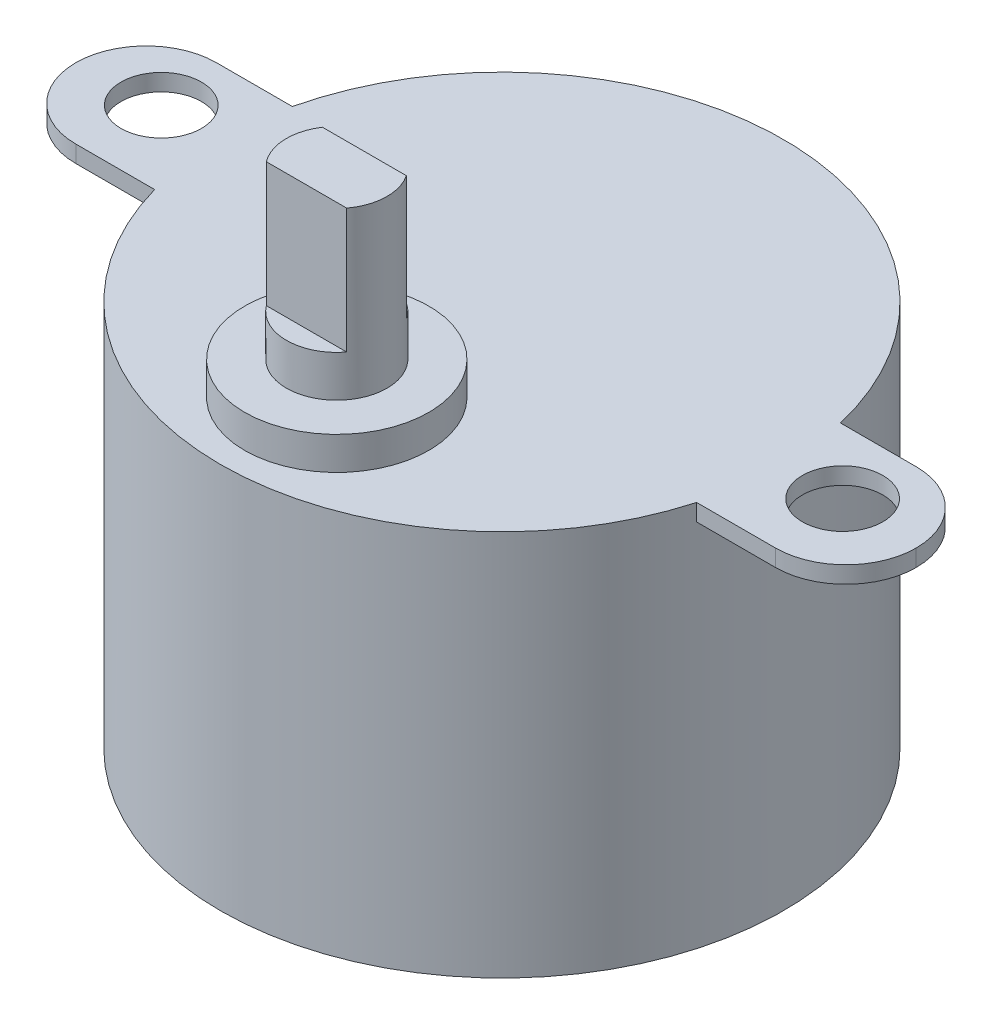
from build123d import *

# Parameters (mm, degrees)
SKETCH1_R           = 14
BOSS_EXTRUDE1_DEPTH = 19.22
SKETCH2_W           = 41.795845618
SKETCH2_H           = 7
BOSS_EXTRUDE2_DEPTH = 0.84
FILLET2_R           = 3.5
SKETCH3_R           = 2
CUT_EXTRUDE1_DEPTH  = 0.84
SKETCH4_R           = 4.58
BOSS_EXTRUDE3_DEPTH = 1.64
SKETCH5_R           = 2.5
BOSS_EXTRUDE4_DEPTH = 8.26
SKETCH6_OUTSIDE_W   = 55.422
SKETCH6_OUTSIDE_H   = 41.626
SKETCH6_OUTSIDE_W_2 = 6.15537624
SKETCH6_OUTSIDE_H_2 = 2.88
CUT_EXTRUDE2_DEPTH  = 6.2


with BuildPart() as part:
    # Sketch1 → Boss-Extrude1 (new body)
    with BuildSketch(Plane(origin=(0, 0, 0), x_dir=(1, 0, 0), z_dir=(0, 1, 0))):
        with Locations(Location((0, 0, 0), (0, 0, 270))):
            Circle(SKETCH1_R)
    extrude(amount=BOSS_EXTRUDE1_DEPTH)

    # Sketch2 → Boss-Extrude2 (add)
    with BuildSketch(Plane(origin=(0, 19.22, 0), x_dir=(1, 0, 0), z_dir=(0, 1, 0))):
        with Locations((0, -0.294656178)):
            Rectangle(SKETCH2_W, SKETCH2_H)
    extrude(amount=-BOSS_EXTRUDE2_DEPTH)

    # Fillet2
    fillet2_edges = [part.edges().sort_by_distance(p)[0] for p in [
        (20.897922809, 18.8, -3.205343822),
        (20.897922809, 18.8, 3.794656178),
        (-20.897922809, 18.8, -3.205343822),
        (-20.897922809, 18.8, 3.794656178),
    ]]
    fillet(fillet2_edges, radius=FILLET2_R - 0.0001)  # a hair under: the kernel refuses the full size

    # Sketch3 → Cut-Extrude1 (cut)
    with BuildSketch(Plane(origin=(0, 19.22, 0), x_dir=(1, 0, 0), z_dir=(0, 1, 0))):
        with Locations(Location((-16.94163256, 0, 0), (0, 0, 270))):
            Circle(SKETCH3_R)
        with Locations(Location((16.94163256, 0, 0), (0, 0, 90))):
            Circle(SKETCH3_R)
    extrude(amount=-CUT_EXTRUDE1_DEPTH, mode=Mode.SUBTRACT)

    # Sketch4 → Boss-Extrude3 (add)
    with BuildSketch(Plane(origin=(0, 19.22, 0), x_dir=(1, 0, 0), z_dir=(0, 1, 0))):
        with Locations(Location((0, -8.213475026, 0), (0, 0, 270))):
            Circle(SKETCH4_R)
    extrude(amount=BOSS_EXTRUDE3_DEPTH)

    # Sketch5 → Boss-Extrude4 (add)
    with BuildSketch(Plane(origin=(0, 20.86, 0), x_dir=(1, 0, 0), z_dir=(0, 1, 0))):
        with Locations(Location((0, -8.213475026, 0), (0, 0, 270))):
            Circle(SKETCH5_R)
    extrude(amount=BOSS_EXTRUDE4_DEPTH)

    # Sketch6 outside → Cut-Extrude2 (cut)
    with BuildSketch(Plane(origin=(0, 29.12, 0), x_dir=(1, 0, 0), z_dir=(0, 1, 0))):
        Rectangle(SKETCH6_OUTSIDE_W, SKETCH6_OUTSIDE_H)
        with Locations((0, -8.278567721)):
            Rectangle(SKETCH6_OUTSIDE_W_2, SKETCH6_OUTSIDE_H_2, mode=Mode.SUBTRACT)
    extrude(amount=-CUT_EXTRUDE2_DEPTH, mode=Mode.SUBTRACT)


solid = part.part
